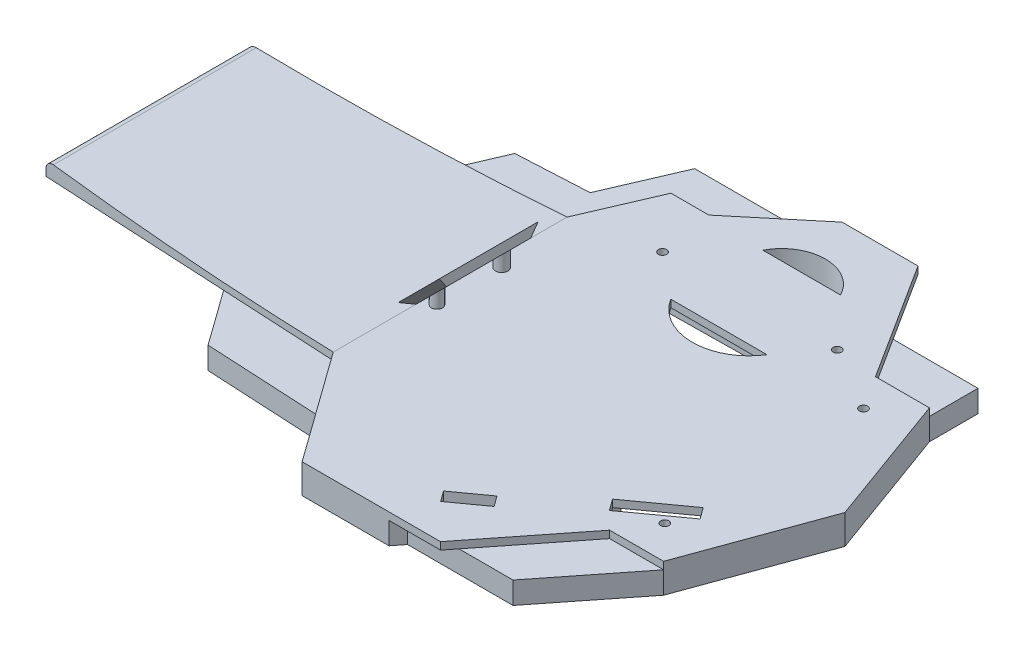
from build123d import *

# Parameters (mm, degrees)
EXTRUDE_1_DEPTH               = 2
EXTRUDE_2_DEPTH               = 2
CUT_EXTRUDE_3_DEPTH           = 202.869395429
CUT_EXTRUDE_3_DEPTH_BACK      = 202.869395429
FILLET_1_R                    = 2
EXTRUDE_4_DEPTH               = 6
CUT_EXTRUDE_7_DEPTH           = 202.98824919
EXTRUDE_5_DEPTH               = 2
EXTRUDE_5_DRAFT               = -45
EXTRUDE_11_REACH              = 204.137
SKETCH_24_R                   = 1.697293379
SKETCH_24_R_2                 = 1.5
CUT_EXTRUDE_8_DEPTH           = 203.13682253
SKETCH_26_W                   = 1.1303
SKETCH_26_H                   = 10
HOLE_WIZARD_4_40_3_AT_2_COUNT = 2
HOLE_WIZARD_4_40_3_AT_2_PITCH = 54.095245987
SKETCH_29_R                   = 3
EXTRUDE_14_DEPTH              = 5
SKETCH_32_W                   = 1.1303
SKETCH_32_H                   = 8
HOLE_WIZARD_4_40_4_AT_2_COUNT = 2
HOLE_WIZARD_4_40_4_AT_2_PITCH = 46.853089657
SKETCH_35_W                   = 1.1303
SKETCH_35_H                   = 6
HOLE_WIZARD_4_40_5_AT_2_COUNT = 2
HOLE_WIZARD_4_40_5_AT_2_PITCH = 67.324981434


with BuildPart() as part:
    # 草图2 → 凸台-拉伸1 (new body)
    with BuildSketch(Plane(origin=(0, 0, 0), x_dir=(1, 0, 0), z_dir=(0, 1, 0))):
        Polygon((141.821582241, 68.082690978), (121.161879345, 68.082690978), (101.35099463, 51.608897425), (91.039832206, 51.608897425), (82.527346571, 31.825074964), (0, 27.5), (0, -27.5), (82.527346571, -31.825074964), (104.14664553, -61.917309022), (141.821582241, -61.917309022), (162.133732132, -36.18552755), (176.829545061, -36.18552755), (190, 0), (176.829545061, 36.18552755), (162.133732132, 36.18552755), align=None)
    extrude(amount=EXTRUDE_1_DEPTH)

    # 草图6 → 凸台-拉伸2 (add)
    with BuildSketch(Plane(origin=(0, 2, 0), x_dir=(1, 0, 0), z_dir=(0, 1, 0))):
        Polygon((82.527346571, 31.825074964), (82.527346571, -31.825074964), (0, -27.5), (0, 27.5), align=None)
    extrude(amount=EXTRUDE_2_DEPTH)

    # 草图7 → 切除-拉伸3 (cut, two sides: drawn at the far end of the back side and taken through both)
    with BuildSketch(Plane.XY.offset(-CUT_EXTRUDE_3_DEPTH_BACK)):
        with BuildLine():
            Line((82.527346571, 2), (82.527346571, 30.740821148))
            Line((82.527346571, 30.740821148), (0, 4))
            add(Edge.make_bspline(
                [(82.527346571, 2), (41.215261335, 1.001172546), (0, 4)],
                knots=[0, 0, 0, 1, 1, 1], degree=2))
        make_face()
    extrude(amount=CUT_EXTRUDE_3_DEPTH + CUT_EXTRUDE_3_DEPTH_BACK, mode=Mode.SUBTRACT)

    # 圆角1
    fillet_1_edges = [part.edges().sort_by_distance(p)[0] for p in [
        (0, 4, 13.75),
    ]]
    fillet(fillet_1_edges, radius=FILLET_1_R)

    # 草图13 → 凸台-拉伸4 (add)
    with BuildSketch(Plane.XZ):
        Polygon((53.501507434, -30.303895193), (58.412275987, -41.716986195), (77.926898746, -42.739704237), (86.484415452, -62.62818317), (136.164724768, -62.62818317), (144.584081331, -49.40685536), (176.829545061, -49.40685536), (176.829545061, -36.18552755), (190, 0), (176.829545061, 36.18552755), (158.743204348, 59.097615602), (130.016377906, 59.097615602), (127.790568727, 61.917309022), (104.14664553, 61.917309022), (93.336996051, 46.871191993), (61.845926158, 45.220814953), (51.036276678, 30.174697924), (171.852914921, 31.825074964), (171.852914921, -31.825074964), align=None)
    extrude(amount=EXTRUDE_4_DEPTH)

    # 草图18 → 切除-拉伸7 (cut, through all)
    with BuildSketch(Plane(origin=(0, 2, 0), x_dir=(1, 0, 0), z_dir=(0, 1, 0))):
        Polygon((169.563862496, -18.125868021), (155.218286362, -28.471875769), (157.463858458, -31.585543016), (171.809434591, -21.239535267), align=None)
        Polygon((130.302091903, -49.564637909), (132.361562224, -52.420260001), (140.814695434, -46.323873151), (138.755225113, -43.468251059), align=None)
    extrude(amount=-CUT_EXTRUDE_7_DEPTH, mode=Mode.SUBTRACT)

    # 草图17 → 切除-拉伸8 (cut, through all)
    with BuildSketch(Plane(origin=(0, 2, 0), x_dir=(1, 0, 0), z_dir=(0, 1, 0))):
        with BuildLine():
            Line((142.181150975, 26.59529287), (116.011181983, 26.59529287))
            ThreePointArc((116.011181983, 26.59529287), (129.096166479, 19.355270398), (142.181150975, 26.59529287))
        make_face()
        with BuildLine():
            Line((116.98958299, 50.681307574), (138.127410429, 50.681307574))
            ThreePointArc((138.127410429, 50.681307574), (127.55849671, 57.129732827), (116.98958299, 50.681307574))
        make_face()
    extrude(amount=-CUT_EXTRUDE_8_DEPTH, mode=Mode.SUBTRACT)

    # 草图26 → #4-40 螺纹孔3 (revolve, cut)
    with BuildSketch(Plane(origin=(168.015540482, 4, 27.047622993), x_dir=(0, 0, 1), z_dir=(1, 0, 0))):
        with Locations((0.56515, 5)):
            Rectangle(SKETCH_26_W, SKETCH_26_H)
    hole_wizard_4_40_3 = revolve(axis=Axis((168.015540482, 10.35, 27.047622993), (0, -1, 0)), mode=Mode.SUBTRACT)

    # #4-40 螺纹孔3 at 2: #4-40 螺纹孔3 ×2
    with Locations(*[(0, 0, -i * HOLE_WIZARD_4_40_3_AT_2_PITCH) for i in range(1, HOLE_WIZARD_4_40_3_AT_2_COUNT)]):
        add(hole_wizard_4_40_3, mode=Mode.SUBTRACT)

    # 草图29 → 凸台-拉伸14 (add)
    with BuildSketch(Plane.XZ):
        with Locations((67.061317629, 25.566411224)):
            Circle(SKETCH_29_R)
        with Locations((67.061317629, -25.566411224)):
            Circle(SKETCH_29_R)
        with Locations((150.788762168, 25.939901438)):
            Circle(SKETCH_29_R)
        with Locations((150.788762168, -25.939901438)):
            Circle(SKETCH_29_R)
    extrude(amount=EXTRUDE_14_DEPTH)

    # 草图32 → #4-40 螺纹孔4 (revolve, cut)
    with BuildSketch(Plane(origin=(150.596814185, 2, -37.335284881), x_dir=(0, 0, 1), z_dir=(1, 0, 0))):
        with Locations((0.56515, 4)):
            Rectangle(SKETCH_32_W, SKETCH_32_H)
    hole_wizard_4_40_4 = revolve(axis=Axis((150.596814185, 8.35, -37.335284881), (0, -1, 0)), mode=Mode.SUBTRACT)

    # #4-40 螺纹孔4 at 2: #4-40 螺纹孔4 ×2
    with Locations(*[Vector(-0.9998795871522861, 0, 0.015518092543031247) * (i * HOLE_WIZARD_4_40_4_AT_2_PITCH) for i in range(1, HOLE_WIZARD_4_40_4_AT_2_COUNT)]):
        add(hole_wizard_4_40_4, mode=Mode.SUBTRACT)

    # 草图35 → #4-40 螺纹孔5 (revolve, cut)
    with BuildSketch(Plane(origin=(176.735584933, 0, 15.639737001), x_dir=(0, 0, 1), z_dir=(1, 0, 0))):
        with Locations((0.56515, 3)):
            Rectangle(SKETCH_35_W, SKETCH_35_H)
    hole_wizard_4_40_5 = revolve(axis=Axis((176.735584933, 6.35, 15.639737001), (0, -1, 0)), mode=Mode.SUBTRACT)

    # #4-40 螺纹孔5 at 2: #4-40 螺纹孔5 ×2
    with Locations(*[Vector(-0.8103060721730658, 0, 0.5860068851126736) * (i * HOLE_WIZARD_4_40_5_AT_2_PITCH) for i in range(1, HOLE_WIZARD_4_40_5_AT_2_COUNT)]):
        add(hole_wizard_4_40_5, mode=Mode.SUBTRACT)


with BuildPart() as body_2:
    # 草图23 → 凸台-拉伸5 (with draft: the straight prism first)
    with BuildSketch(Plane(origin=(40.263673286, -40.263673286, 0), x_dir=(0, 0, -1), z_dir=(-0.7071067811865488, 0.7071067811865464, 0))):
        Polygon((-9.292036768, -59.769859956), (-9.292036768, -60.809778756), (-9.292036768, -71.520555916), (13.638077716, -71.520555916), (13.638077716, -59.769859956), align=None)
    extrude(amount=EXTRUDE_5_DEPTH)
    # 凸台-拉伸5: the draft: its side faces are tilted about the plane it starts from
    extrude_5_sides = [body_2.faces().sort_by_distance(p)[0] for p in [
        (85.974738189, 6.86160518, 9.292036768),
        (85.974738189, 6.86160518, -13.638077716),
        (90.129236587, 11.016103578, -2.173020474),
        (81.82023979, 2.707106781, -2.173020474),
    ]]
    draft(extrude_5_sides, Plane(origin=(40.263673286, -40.263673286, 0), x_dir=(0, 0, -1), z_dir=(-0.7071067811865488, 0.7071067811865464, 0)), EXTRUDE_5_DRAFT)


with BuildPart() as body_3:
    # 凸台-拉伸11: up to this plane
    extrude_11_end = Plane(origin=(40.263673286, -40.263673286, 0), z_dir=(0.7071067811865476, -0.7071067811865476, 0))
    # 草图24 → 凸台-拉伸11 (new, up to the surface)
    with BuildSketch(Plane(origin=(0, 2, 0), x_dir=(1, 0, 0), z_dir=(0, 1, 0)), mode=Mode.PRIVATE) as extrude_11_sk1:
        with Locations((85.490261725, 11.047785882)):
            Circle(SKETCH_24_R)
    extrude_11_tool1 = split(extrude(extrude_11_sk1.sketch, amount=EXTRUDE_11_REACH, mode=Mode.PRIVATE), bisect_by=extrude_11_end, keep=Keep.BOTH, mode=Mode.PRIVATE)
    add(extrude_11_tool1.solids().sort_by_distance((85.490262, 2, -11.047786))[0])
    # 草图24 → 凸台-拉伸11 (new, up to the surface)
    with BuildSketch(Plane(origin=(0, 2, 0), x_dir=(1, 0, 0), z_dir=(0, 1, 0)), mode=Mode.PRIVATE) as extrude_11_sk2:
        with Locations((85.490261725, -6.54134788)):
            Circle(SKETCH_24_R_2)
    extrude_11_tool2 = split(extrude(extrude_11_sk2.sketch, amount=EXTRUDE_11_REACH, mode=Mode.PRIVATE), bisect_by=extrude_11_end, keep=Keep.BOTH, mode=Mode.PRIVATE)
    add(extrude_11_tool2.solids().sort_by_distance((85.490262, 2, 6.541348))[0])


solid = Compound([part.part, body_2.part, body_3.part])
